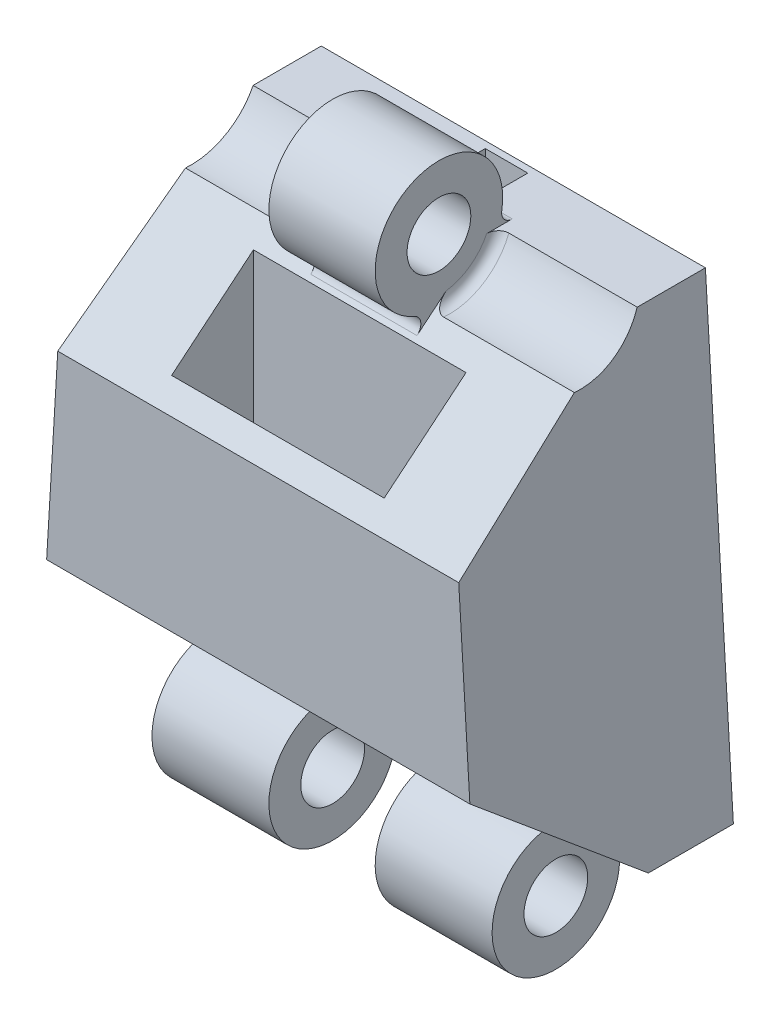
from build123d import *

# Parameters (mm, degrees)
BOSS_EXTRUDE1_DEPTH            = 12
CUT_EXTRUDE1_DEPTH             = 28.113370808
CUT_EXTRUDE1_DEPTH_BACK        = 28.113370808
SKETCH6_R                      = 3
SKETCH6_R_2                    = 1.5
BOSS_EXTRUDE2_DEPTH            = 8
SKETCH6_3_R                    = 3
SKETCH6_3_R_2                  = 1.5
CUT_EXTRUDE2_DEPTH             = 2.5
CUT_EXTRUDE3_DEPTH             = 28.113370808
CUT_EXTRUDE3_DEPTH_BACK        = 28.113370808
SKETCH9_R                      = 3
SKETCH9_R_2                    = 1.5
BOSS_EXTRUDE3_DEPTH            = 2.5
CUT_EXTRUDE4_START             = 10
SKETCH11_R                     = 3
CUT_EXTRUDE4_DEPTH             = 10
SKETCH12_R                     = 3
CUT_EXTRUDE5_DEPTH             = 10
FILLET1_R                      = 0.5
FILLET2_R                      = 0.5
CUT_EXTRUDE6_REACH             = 62.032
SKETCH14_W                     = 10
SKETCH14_H                     = 3.849855631
CUT_EXTRUDE6_DIRECTION_2_REACH = 62.032
SKETCH15_W                     = 2
SKETCH15_H                     = 24.973995696
CUT_EXTRUDE7_DEPTH             = 1


with BuildPart() as part:
    # Sketch1 → Boss-Extrude1 (new body)
    with BuildSketch(Plane.XY):
        Polygon((-56.5742778, 0), (-35.873082033, 0), (-37.188679916, 22), (-55.258679916, 22), align=None)
    extrude(amount=BOSS_EXTRUDE1_DEPTH)

    # Sketch3 → Cut-Extrude1 (cut, two sides: drawn at the far end of the back side and taken through both)
    with BuildSketch(Plane(origin=(-46.223679916, 0, 0), x_dir=(0, 0, -1), z_dir=(1, 0, 0)).offset(-CUT_EXTRUDE1_DEPTH_BACK)):
        Polygon((-12, 0), (-4, 0), (-12, 6.613954944), align=None)
    extrude(amount=CUT_EXTRUDE1_DEPTH + CUT_EXTRUDE1_DEPTH_BACK, mode=Mode.SUBTRACT)

    # Sketch6 → Boss-Extrude2 (add, symmetric)
    with BuildSketch(Plane(origin=(-46.223679916, 0, 0), x_dir=(0, 0, -1), z_dir=(1, 0, 0))):
        with Locations((-6, -1.1)):
            Circle(SKETCH6_R)
        with Locations((-6, -1.1)):
            Circle(SKETCH6_R_2, mode=Mode.SUBTRACT)
    extrude(amount=BOSS_EXTRUDE2_DEPTH, both=True)

    # Sketch6<3> → Cut-Extrude2 (cut, symmetric)
    with BuildSketch(Plane(origin=(-46.223679916, 0, 0), x_dir=(0, 0, -1), z_dir=(1, 0, 0))):
        with Locations((-6, -1.1)):
            Circle(SKETCH6_3_R)
        with Locations((-6, -1.1)):
            Circle(SKETCH6_3_R_2, mode=Mode.SUBTRACT)
    extrude(amount=CUT_EXTRUDE2_DEPTH, both=True, mode=Mode.SUBTRACT)

    # Sketch8 → Cut-Extrude3 (cut, two sides: drawn at the far end of the back side and taken through both)
    with BuildSketch(Plane(origin=(-46.223679916, 0, 0), x_dir=(0, 0, -1), z_dir=(1, 0, 0)).offset(-CUT_EXTRUDE3_DEPTH_BACK)):
        Polygon((-12, 15.370362001), (-4, 22), (-12, 22), align=None)
    extrude(amount=CUT_EXTRUDE3_DEPTH + CUT_EXTRUDE3_DEPTH_BACK, mode=Mode.SUBTRACT)

    # Sketch9 → Boss-Extrude3 (add, symmetric)
    with BuildSketch(Plane(origin=(-46.223679916, 0, 0), x_dir=(0, 0, -1), z_dir=(1, 0, 0))):
        with Locations((-6, 23.1)):
            Circle(SKETCH9_R)
        with Locations((-6, 23.1)):
            Circle(SKETCH9_R_2, mode=Mode.SUBTRACT)
    extrude(amount=BOSS_EXTRUDE3_DEPTH, both=True)

    # Sketch11 → Cut-Extrude4 (cut)
    with BuildSketch(Plane(origin=(-43.723679916, 0, 0), x_dir=(0, 0, -1), z_dir=(1, 0, 0)).offset(CUT_EXTRUDE4_START)):
        with Locations((-6, 23.1)):
            Circle(SKETCH11_R)
    extrude(amount=-CUT_EXTRUDE4_DEPTH, mode=Mode.SUBTRACT)

    # Sketch12 → Cut-Extrude5 (cut)
    with BuildSketch(Plane.ZY.offset(48.723679916)):
        with Locations((6, 23.1)):
            Circle(SKETCH12_R)
    extrude(amount=CUT_EXTRUDE5_DEPTH, mode=Mode.SUBTRACT)

    # Fillet1
    fillet1_edges = [part.edges().sort_by_distance(p)[0] for p in [
        (-46.223679916, 22, 3.208942853),
        (-46.223679916, 20.112838065, 6.277242812),
    ]]
    fillet(fillet1_edges, radius=FILLET1_R)

    # Fillet2
    fillet2_edges = [part.edges().sort_by_distance(p)[0] for p in [
        (-48.723679916, 20.54464497, 4.42832552),
        (-43.723679916, 20.54464497, 4.42832552),
    ]]
    fillet(fillet2_edges, radius=FILLET2_R)

    # Cut-Extrude6: up to this plane
    cut_extrude6_end = Plane(origin=(-56.5742778, -1.96433929, 1.624006445), z_dir=(0, 0.7707129094412332, -0.6371825572162422))
    # Sketch14 → Cut-Extrude6 (cut, up to the surface)
    with BuildSketch(Plane(origin=(0, 10, 0), x_dir=(1, 0, 0), z_dir=(0, 1, 0)), mode=Mode.PRIVATE) as cut_extrude6_sk1:
        with Locations((-46.223679916, -9.151106834)):
            Rectangle(SKETCH14_W, SKETCH14_H)
    cut_extrude6_tool1 = split(extrude(cut_extrude6_sk1.sketch, amount=-CUT_EXTRUDE6_REACH, mode=Mode.PRIVATE), bisect_by=cut_extrude6_end, keep=Keep.BOTH, mode=Mode.PRIVATE)
    add(cut_extrude6_tool1.solids().sort_by_distance((-46.22368, 10, 9.151107))[0], mode=Mode.SUBTRACT)

    # Cut-Extrude6 direction 2: up to this plane
    cut_extrude6_direction_2_end = Plane(origin=(-56.5742778, 15.008030561, 12.437226213), z_dir=(0, 0.769971126082772, 0.6380787294674757))
    # Sketch14 → Cut-Extrude6 direction 2 (cut, up to the surface)
    with BuildSketch(Plane(origin=(0, 10, 0), x_dir=(1, 0, 0), z_dir=(0, 1, 0)), mode=Mode.PRIVATE) as cut_extrude6_direction_2_sk1:
        with Locations((-46.223679916, -9.151106834)):
            Rectangle(SKETCH14_W, SKETCH14_H)
    cut_extrude6_direction_2_tool1 = split(extrude(cut_extrude6_direction_2_sk1.sketch, amount=CUT_EXTRUDE6_DIRECTION_2_REACH, mode=Mode.PRIVATE), bisect_by=cut_extrude6_direction_2_end, keep=Keep.BOTH, mode=Mode.PRIVATE)
    add(cut_extrude6_direction_2_tool1.solids().sort_by_distance((-46.22368, 10, 9.151107))[0], mode=Mode.SUBTRACT)

    # Sketch15 → Cut-Extrude7 (cut, symmetric)
    with BuildSketch(Plane(origin=(-46.223679916, 0, 0), x_dir=(0, 0, -1), z_dir=(1, 0, 0))):
        with Locations((-1.32, 9.513002152)):
            Rectangle(SKETCH15_W, SKETCH15_H)
    extrude(amount=CUT_EXTRUDE7_DEPTH, both=True, mode=Mode.SUBTRACT)


solid = part.part
